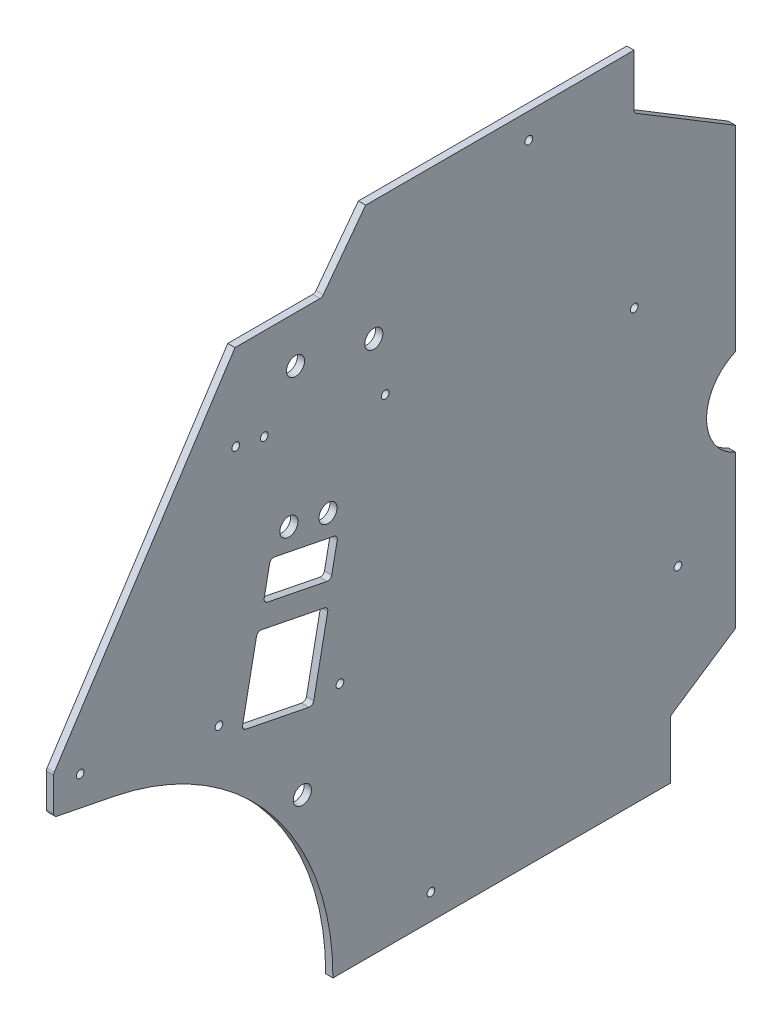
from build123d import *

# Parameters (mm, degrees)
BASE_FLANGE1_DEPTH               = 6.35
F_1_4_CLEARANCE_HOLE1_D          = 6.7564
CUT_EXTRUDE1_DEPTH               = 1200.074385724
F_27_32_0_84375_DIAMETER_HOLE1_D = 21.43125
CUT_EXTRUDE2_DEPTH               = 1200.074385724
CUT_EXTRUDE3_DEPTH               = 1200.074385724
CUT_EXTRUDE5_DEPTH               = 1200.074385724
CUT_EXTRUDE6_DEPTH               = 1183.362497291
CUT_EXTRUDE7_DEPTH               = 1183.362497291
CUT_EXTRUDE8_DEPTH               = 1183.362497291
F_5_8_0_625_DIAMETER_HOLE1_D     = 15.875
FILLET2_R                        = 3.556


# Sheet-metal steps are written as plain solids
with BuildPart() as part:
    # Sketch1 → Base-Flange1 (new body)
    with BuildSketch(Plane(origin=(0, 0, 0), x_dir=(0, 0, -1), z_dir=(1, 0, 0))):
        with BuildLine():
            Line((-1054.1, 247.773526455), (-876.3, 520.7))
            Line((-876.3, 520.7), (-800.1, 520.7))
            Line((-800.1, 520.7), (-800.1, 571.5))
            Line((-800.1, 571.5), (-438.15, 571.5))
            Line((-438.15, 571.5), (-438.15, 125.253453767))
            Line((-438.15, 125.253453767), (-438.15, 0))
            Line((-438.15, 0), (-790.575, 0))
            ThreePointArc((-790.575, 0), (-844.607803402, 151.01156908), (-982.176450511, 233.467042956))
            Line((-982.176450511, 233.467042956), (-1054.1, 247.773526455))
        make_face()
    extrude(amount=-BASE_FLANGE1_DEPTH)

    # 1/4 Clearance Hole1 (through all)
    with Locations(Plane(origin=(0, 0, 0), x_dir=(0, 0, -1), z_dir=(1, 0, 0))):
        with Locations((-704.85, 22.225), (-1011.776786637, 265.252531308), (-488.62591807, 161.191353545), (-875.60064198, 445.346335342), (-526.833396269, 375.972216833), (-850.688695858, 440.391041163), (-744.812924838, 419.331040901), (-890.331049291, 241.095472185), (-784.455278272, 220.035471923), (-619.125, 549.275)):
            Hole(F_1_4_CLEARANCE_HOLE1_D / 2)

    # Sketch11 → Cut-Extrude1 (cut, through all)
    with BuildSketch(Plane(origin=(0, 0, 0), x_dir=(0, 0, -1), z_dir=(1, 0, 0))):
        Polygon((-845.296687768, 345.439648176), (-786.130815728, 333.670824501), (-792.324933452, 302.530891848), (-851.490805492, 314.299715524), align=None)
    extrude(amount=-CUT_EXTRUDE1_DEPTH, mode=Mode.SUBTRACT)

    # 27/32 (0.84375) Diameter Hole1 (through all)
    with Locations(Plane(origin=(0, 0, 0), x_dir=(0, 0, -1), z_dir=(1, 0, 0))):
        with Locations((-849.855910604, 239.518870383), (-822.45276987, 234.068046786)):
            Hole(F_27_32_0_84375_DIAMETER_HOLE1_D / 2)

    # Sketch14 → Cut-Extrude2 (cut, through all)
    with BuildSketch(Plane(origin=(0, 0, 0), x_dir=(0, 0, -1), z_dir=(1, 0, 0))):
        Polygon((-864.197214028, 258.557542635), (-870.391331752, 227.417609982), (-808.111466446, 215.029374534), (-801.917348722, 246.169307187), (-794.484407453, 283.53722637), (-856.764272759, 295.925461818), align=None)
    extrude(amount=-CUT_EXTRUDE2_DEPTH, mode=Mode.SUBTRACT)

    # Sketch15 → Cut-Extrude3 (cut, through all)
    with BuildSketch(Plane(origin=(0, 0, 0), x_dir=(0, 0, -1), z_dir=(1, 0, 0))):
        Polygon((-438.15, 571.5), (-476.25, 571.5), (-476.25, 523.875), (-438.15, 501.877954744), align=None)
        Polygon((-438.15, 0), (-495.3, 0), (-495.3, 50.8), (-438.15, 88.9), align=None)
    extrude(amount=-CUT_EXTRUDE3_DEPTH, mode=Mode.SUBTRACT)

    # Sketch17 → Cut-Extrude5 (cut, through all)
    with BuildSketch(Plane.ZY.offset(6.35)):
        Polygon((1035.05, 277.01564862), (1035.05, 243.984245856), (1054.1, 247.773526455), align=None)
    extrude(amount=-CUT_EXTRUDE5_DEPTH, mode=Mode.SUBTRACT)

    # Sketch18 → Cut-Extrude6 (cut, through all)
    with BuildSketch(Plane.ZY.offset(6.35)):
        Polygon((476.25, 523.875), (438.15, 501.877954744), (438.15, 470.127954744), (527.05, 523.875), (527.05, 571.5), (476.25, 571.5), align=None)
    extrude(amount=-CUT_EXTRUDE6_DEPTH, mode=Mode.SUBTRACT)

    # Sketch20 → Cut-Extrude7 (cut, through all)
    with BuildSketch(Plane.ZY.offset(6.35)):
        with BuildLine():
            Line((438.15, 298.599947238), (438.15, 222.399947238))
            ThreePointArc((438.15, 222.399947238), (463.55, 260.499947238), (438.15, 298.599947238))
        make_face()
    extrude(amount=-CUT_EXTRUDE7_DEPTH, mode=Mode.SUBTRACT)

    # Sketch22 → Cut-Extrude8 (cut, through all)
    with BuildSketch(Plane.ZY.offset(6.35)):
        Polygon((800.1, 520.7), (762, 571.5), (800.1, 571.5), align=None)
    extrude(amount=-CUT_EXTRUDE8_DEPTH, mode=Mode.SUBTRACT)

    # 5/8 (0.625) Diameter Hole1 (through all)
    with Locations(Plane(origin=(0, 0, 0), x_dir=(0, 0, -1), z_dir=(1, 0, 0))):
        with Locations((-823.332971453, 480.270476242), (-754.825119616, 466.643417249), (-817.385708629, 152.130097456), (-829.173016653, 361.400764358), (-794.919090735, 354.587234862)):
            Hole(F_5_8_0_625_DIAMETER_HOLE1_D / 2)

    # Fillet2
    fillet2_edges = [part.edges().sort_by_distance(p)[0] for p in [
        (-3.175, 314.299715524, 851.490805492),
        (-3.175, 345.439648176, 845.296687768),
        (-3.175, 333.670824501, 786.130815728),
        (-3.175, 302.530891848, 792.324933452),
        (-3.175, 295.925461818, 856.764272759),
        (-3.175, 283.53722637, 794.484407453),
        (-3.175, 215.029374534, 808.111466446),
        (-3.175, 227.417609982, 870.391331752),
        (-3.175, 520.7, 800.1),
        (-3.175, 50.8, 495.3),
        (-3.175, 277.01564862, 1035.05),
        (-3.175, 243.984245856, 1035.05),
        (-3.175, 523.875, 527.05),
    ]]
    fillet(fillet2_edges, radius=FILLET2_R)


solid = part.part
